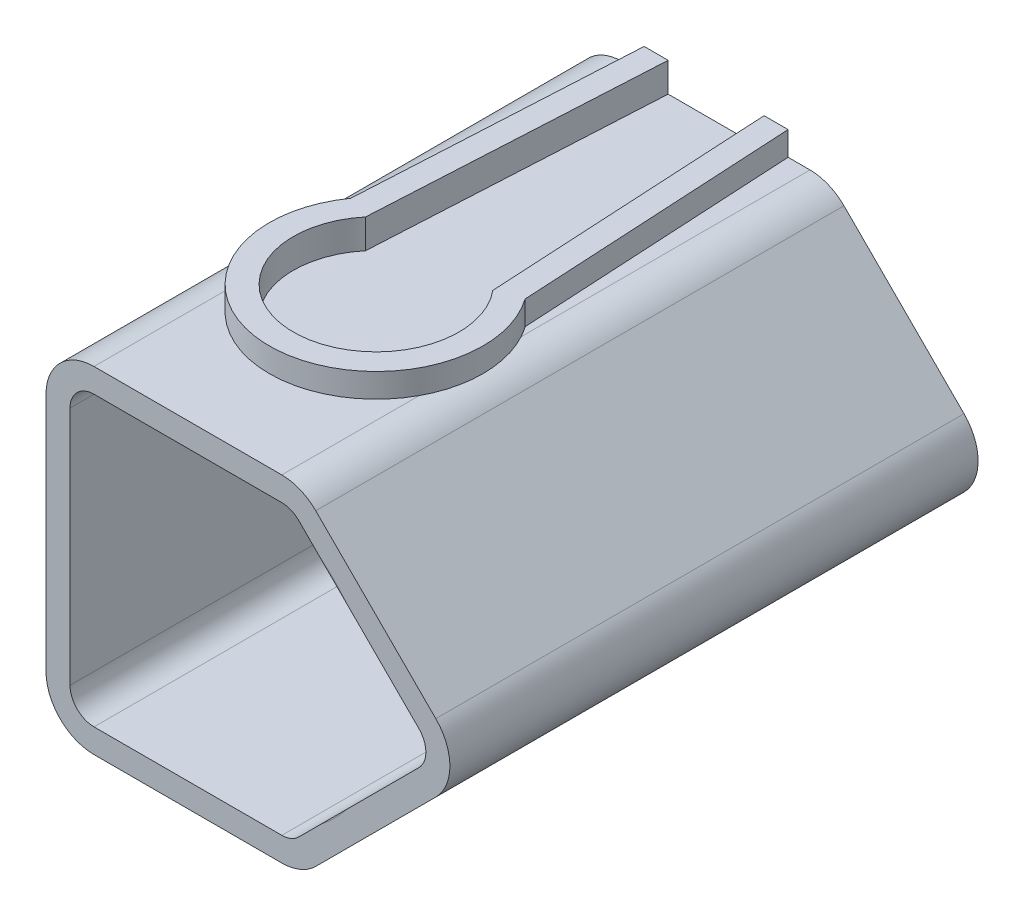
from build123d import *

# Parameters (mm, degrees)
BOSS_EXTRU_1_DEPTH           = 22
CONG_1_R                     = 1
CONG_2_R                     = 2
ENL_V_MAT_EXTRU_2_DEPTH      = 3
ENL_V_MAT_EXTRU_2_DEPTH_BACK = 2
ESQUISSE3_R                  = 1
ENL_V_MAT_EXTRU_5_DEPTH      = 0.22
BOSS_EXTRU_3_START           = 2.5
ESQUISSE8_R                  = 2
ESQUISSE8_R_2                = 1
BOSS_EXTRU_3_DEPTH           = 2.5
NERVURE2_REACH               = 124.576
ESQUISSE13_WALL_W            = 250.687529102
ESQUISSE13_WALL_H            = 1
R_P_TITION_CIRCULAIRE1_COUNT = 4
BOSS_EXTRU_6_START           = 1
BOSS_EXTRU_6_DEPTH           = 1
FRACTIONNER1_DEPTH           = 22
FRACTIONNER1_2_DEPTH         = 22
FRACTIONNER1_3_DEPTH         = 22


# Read off the part's stored shape, not the designer's step: Fractionner1
with BuildPart() as part:
    # Esquisse1 → Boss.-Extru.1 (new body)
    with BuildSketch(Plane.XY):
        Polygon((-117.882204612, 56.101961411), (-107.232709675, 56.101961411), (-100.232709675, 63.101961411), (-107.232709675, 70.101961411), (-117.882204612, 70.101961411), align=None)
        Polygon((-116.882204612, 57.101961411), (-107.646923238, 57.101961411), (-101.646923238, 63.101961411), (-107.646923238, 69.101961411), (-116.882204612, 69.101961411), align=None, mode=Mode.SUBTRACT)
    extrude(amount=BOSS_EXTRU_1_DEPTH)

    # Congé1
    cong_1_edges = [part.edges().sort_by_distance(p)[0] for p in [
        (-116.882204612, 69.101961411, 11),
        (-116.882204612, 57.101961411, 11),
        (-107.646923238, 57.101961411, 11),
        (-101.646923238, 63.101961411, 11),
        (-107.646923238, 69.101961411, 11),
    ]]
    fillet(cong_1_edges, radius=CONG_1_R)

    # Congé2
    cong_2_edges = [part.edges().sort_by_distance(p)[0] for p in [
        (-117.882204612, 70.101961411, 11),
        (-107.232709675, 70.101961411, 11),
        (-100.232709675, 63.101961411, 11),
        (-107.232709675, 56.101961411, 11),
        (-117.882204612, 56.101961411, 11),
    ]]
    fillet(cong_2_edges, radius=CONG_2_R)

    # Esquisse3 → Enlèv. mat.-Extru.2 (cut, two sides: drawn at the far end of the back side and taken through both)
    with BuildSketch(Plane.ZY.offset(117.882204612).offset(-ENL_V_MAT_EXTRU_2_DEPTH_BACK)):
        with Locations(Location((11, 63.101961411, 0), (0, 0, 180))):
            Circle(ESQUISSE3_R)
    extrude(amount=ENL_V_MAT_EXTRU_2_DEPTH + ENL_V_MAT_EXTRU_2_DEPTH_BACK, mode=Mode.SUBTRACT)

    # Esquisse6 → Enlèv. mat.-Extru.5 (cut)
    with BuildSketch(Plane(origin=(0, 70.101961411, 0), x_dir=(1, 0, 0), z_dir=(0, 1, 0))):
        with BuildLine():
            Line((-109.974649826, 0), (-109.321670706, -11.950049764))
            ThreePointArc((-109.321670706, -11.950049764), (-111.971670706, -17.609121967), (-114.621670706, -11.950049764))
            Line((-114.621670706, -11.950049764), (-113.968691586, 0))
            Line((-113.968691586, 0), (-109.974649826, 0))
        make_face()
    extrude(amount=-ENL_V_MAT_EXTRU_5_DEPTH, mode=Mode.SUBTRACT)

    # Esquisse8 → Boss.-Extru.3 (add)
    with BuildSketch(Plane.ZY.offset(117.882204612).offset(BOSS_EXTRU_3_START)):
        with Locations(Location((11, 63.101961411, 0), (0, 0, 180))):
            Circle(ESQUISSE8_R)
        with Locations(Location((11, 63.101961411, 0), (0, 0, 180))):
            Circle(ESQUISSE8_R_2, mode=Mode.SUBTRACT)
    extrude(amount=-BOSS_EXTRU_3_DEPTH)

    # Esquisse13 wall → Nervure2 (add, up to next)
    with BuildSketch(Plane(origin=(-119.132204612, 63.101961411, 14.05), x_dir=(0.707106781187, 0, 0.707106781187), z_dir=(0.707106781187, 0, -0.707106781187)), mode=Mode.PRIVATE) as nervure2_sk1:
        Rectangle(ESQUISSE13_WALL_W, ESQUISSE13_WALL_H)
    nervure2_tool1 = extrude(nervure2_sk1.sketch, amount=NERVURE2_REACH, mode=Mode.PRIVATE) - part.part
    nervure2 = nervure2_tool1.solids().sort_by_distance((-119.132204612, 63.101961411, 14.05))[0]
    add(nervure2)

    # Répétition circulaire1: Nervure2 ×4 about axis
    r_p_tition_circulaire1_axis = Axis((0, 63.101961411, 11), (1, 0, 0))
    for i in range(1, R_P_TITION_CIRCULAIRE1_COUNT):
        add(nervure2.rotate(r_p_tition_circulaire1_axis, i * 360 / R_P_TITION_CIRCULAIRE1_COUNT))

    # Esquisse17 → Boss.-Extru.6 (add)
    with BuildSketch(Plane(origin=(0, 70.101961411, 0), x_dir=(1, 0, 0), z_dir=(0, 1, 0)).offset(BOSS_EXTRU_6_START)):
        with BuildLine():
            Line((-113.968691586, 0), (-114.970174136, 0.000168947))
            Line((-114.970174136, 0.000168947), (-115.603350156, -11.587467952))
            ThreePointArc((-115.603350156, -11.587467952), (-111.971670706, -18.609121967), (-108.339991256, -11.587467952))
            Line((-108.339991256, -11.587467952), (-108.973157096, -1.7339e-05))
            Line((-108.973157096, -1.7339e-05), (-109.974649826, 0))
            Line((-109.974649826, 0), (-109.321670706, -11.950049764))
            ThreePointArc((-109.321670706, -11.950049764), (-111.971670706, -17.609121967), (-114.621670706, -11.950049764))
            Line((-114.621670706, -11.950049764), (-113.968691586, 0))
        make_face()
    extrude(amount=-BOSS_EXTRU_6_DEPTH)

    # Fractionner1 3 outline → Fractionner1 3 (cut)
    with BuildSketch(Plane.XY):
        with BuildLine():
            ThreePointArc((-106.438426385, 58.310458264), (-105.854208586, 58.823965385), (-105.340701465, 59.408183184))
            Line((-105.340701465, 59.408183184), (-106.438426385, 58.310458264))
        make_face()
        with BuildLine():
            ThreePointArc((-105.340701465, 66.795739638), (-105.854208586, 67.379957437), (-106.438426385, 67.893464558))
            Line((-106.438426385, 67.893464558), (-105.340701465, 66.795739638))
        make_face()
    extrude(amount=FRACTIONNER1_3_DEPTH, mode=Mode.SUBTRACT)


with BuildPart() as body_2:
    # Fractionner1 outline → Fractionner1 (new body)
    with BuildSketch(Plane.XY):
        with BuildLine():
            ThreePointArc((-106.438426385, 58.310458264), (-105.854208586, 58.823965385), (-105.340701465, 59.408183184))
            Line((-105.340701465, 59.408183184), (-106.438426385, 58.310458264))
        make_face()
    extrude(amount=FRACTIONNER1_DEPTH)


with BuildPart() as body_3:
    # Fractionner1 2 outline → Fractionner1 2 (new body)
    with BuildSketch(Plane.XY):
        with BuildLine():
            ThreePointArc((-105.340701465, 66.795739638), (-105.854208586, 67.379957437), (-106.438426385, 67.893464558))
            Line((-106.438426385, 67.893464558), (-105.340701465, 66.795739638))
        make_face()
    extrude(amount=FRACTIONNER1_2_DEPTH)


solid = Compound([part.part, body_2.part, body_3.part])
